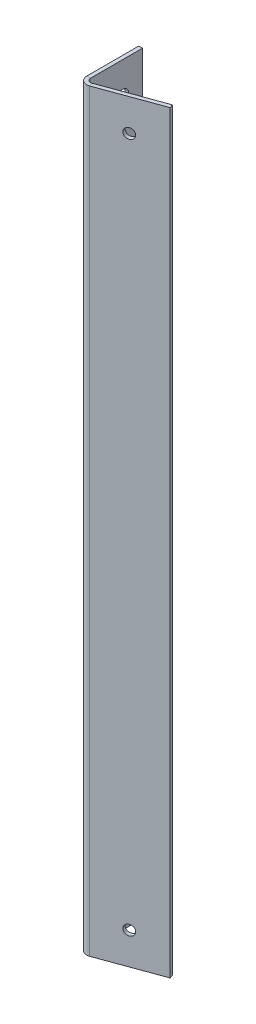
from build123d import *

# Parameters (mm, degrees)
SKETCH1_W                = 300
SKETCH1_H                = 50
BASE_FLANGE1_DEPTH       = 1.5
SKETCHED_START           = -150
SKETCHED_BEND1_DEPTH     = 300
SKETCHED_BEND1_2_DEPTH   = 300
F_4_0_4_DIAMETER_HOLE1_D = 4
F_5_0_5_DIAMETER_HOLE1_D = 5


# Read off the part's stored shape, not the designer's step: Sketched Bend1
# Sheet-metal steps are written as plain solids
with BuildPart() as part:
    # Sketch1 → Base-Flange1 (new body)
    with BuildSketch(Plane.YZ):
        Rectangle(SKETCH1_W, SKETCH1_H)
    extrude(amount=-BASE_FLANGE1_DEPTH)

    # Sketched Bend1 outline → Sketched Bend1 (cut)
    with BuildSketch(Plane(origin=(0, 0, 0), x_dir=(1, 0, 0), z_dir=(0, 1, 0)).offset(SKETCHED_START)):
        with BuildLine():
            Line((0, -25), (0, 1.686367809))
            ThreePointArc((0, 1.686367809), (-1.098076211, 2.78444402), (-1.5, 4.28444402))
            Line((-1.5, 4.28444402), (-1.5, -25))
            Line((-1.5, -25), (0, -25))
        make_face()
    extrude(amount=SKETCHED_BEND1_DEPTH, mode=Mode.SUBTRACT)

    # Sketched Bend1 2 outline → Sketched Bend1 2 (add)
    with BuildSketch(Plane(origin=(0, 0, 0), x_dir=(1, 0, 0), z_dir=(0, 1, 0)).offset(SKETCHED_START)):
        with BuildLine():
            Line((25.472225443, 11.413353872), (2.013030215, 2.874905089))
            ThreePointArc((2.013030215, 2.874905089), (0.639635346, 3.055715954), (0, 4.28444402))
            Line((0, 4.28444402), (0, 1.686367809))
            ThreePointArc((0, 1.686367809), (1.238532772, 1.295859926), (2.52606043, 1.465366158))
            Line((2.52606043, 1.465366158), (25.985255658, 10.003814941))
            Line((25.985255658, 10.003814941), (25.472225443, 11.413353872))
        make_face()
    extrude(amount=SKETCHED_BEND1_2_DEPTH)

    # Ø4.0 (4) Diameter Hole1 (through all)
    with Locations(Plane(origin=(-0.175466668, 0, -0.482090707), x_dir=(0, -1, 0), z_dir=(0.3420201433256727, 0, 0.9396926207859071))):
        with Locations((-137.3, 15.139659211), (137.3, 15.139659211)):
            Hole(F_4_0_4_DIAMETER_HOLE1_D / 2)

    # Ø5.0 (5) Diameter Hole1 (through all)
    with Locations(Plane(origin=(-1.5, 0, 0), x_dir=(0, -1, 0), z_dir=(-1, 0, 0))):
        with Locations((-137.3, -16.98444402), (137.3, -16.98444402), (0, -16.98444402)):
            Hole(F_5_0_5_DIAMETER_HOLE1_D / 2)


solid = part.part
